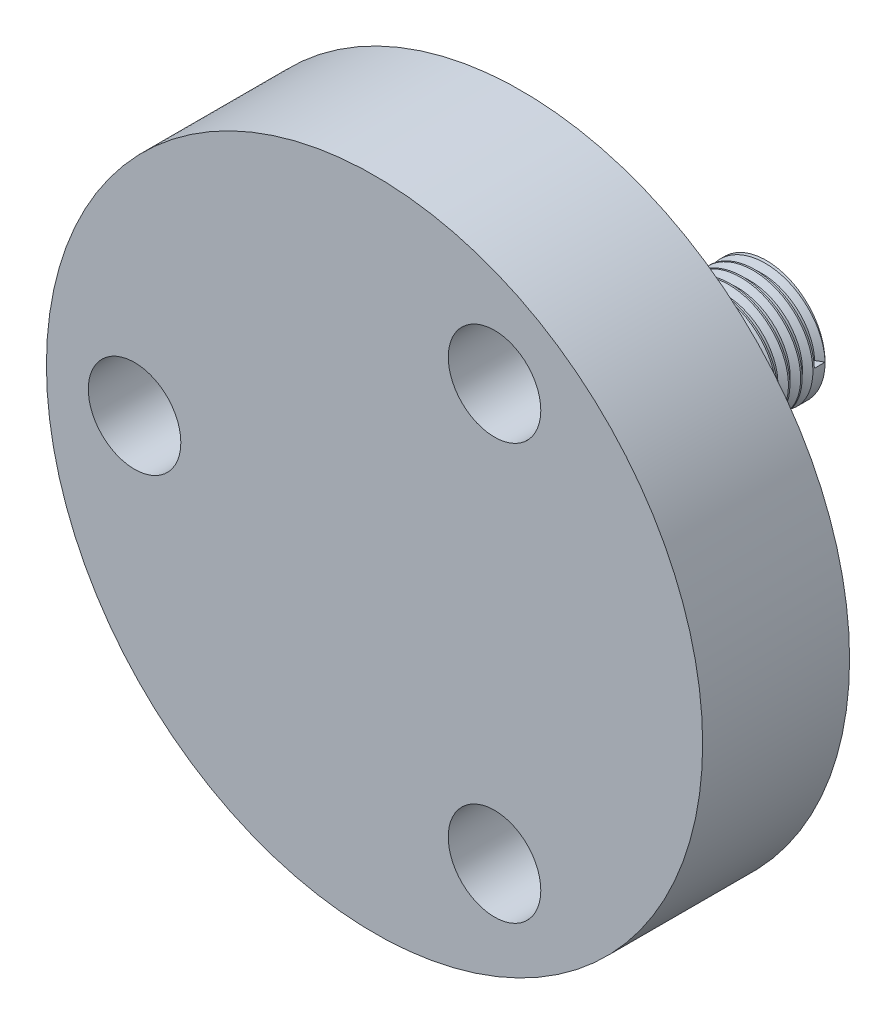
from build123d import *

# Parameters (mm, degrees)
SKETCH2_R            = 8.509
BOSS_EXTRUDE1_DEPTH  = 3.81
M2_CLEARANCE_HOLE1_D = 2.4
SKETCH8_R            = 1.524
BOSS_EXTRUDE2_DEPTH  = 6.35
THREAD1_PITCH        = 0.3175


with BuildPart() as part:
    # Sketch2 → Boss-Extrude1 (new body)
    with BuildSketch(Plane.XY):
        with Locations(Location((0, 0, 0), (0, 0, 180))):
            Circle(SKETCH2_R)
    extrude(amount=BOSS_EXTRUDE1_DEPTH)

    # M2 Clearance Hole1 (through all)
    with Locations(Plane.XY.offset(3.81)):
        with Locations((-6.223, 0), (3.1115, 5.389276088), (3.1115, -5.389276088)):
            Hole(M2_CLEARANCE_HOLE1_D / 2)

    # Sketch8 → Boss-Extrude2 (add)
    with BuildSketch(Plane(origin=(0, 0, 0), x_dir=(-1, 0, 0), z_dir=(0, 0, -1))):
        with Locations(Location((0, 0, 0), (0, 0, 180))):
            Circle(SKETCH8_R)
    extrude(amount=BOSS_EXTRUDE2_DEPTH)

    # Thread1: the profile of Thread Profile2 profile screwed along a right-hand helix of 20 turns, 6 arcs to a turn; built about Z, then put on its axis
    thread1_z = Axis((0, 0, 0), (0, 0, 1))
    thread1_corners = [(1.5243, 0, -0.000173205), (1.5243, 0, 0.277985704), (1.352148085, 0, 0.17859375), (1.352148085, 0, 0.09921875)]
    with BuildLine(mode=Mode.PRIVATE) as thread1_profile:
        Line(thread1_corners[0], thread1_corners[1])
        Line(thread1_corners[1], thread1_corners[2])
        Line(thread1_corners[2], thread1_corners[3])
        Line(thread1_corners[3], thread1_corners[0])
    thread1_cap = Face(thread1_profile.wire())
    thread1_turn_angles = [0, 30, 60, 90, 120, 150, 180, 210, 240, 270, 300, 330, 360]
    thread1_turn_weights = [1, 0.8660254037844387, 1, 0.8660254037844387, 1, 0.8660254037844387, 1, 0.8660254037844387, 1, 0.8660254037844387, 1, 0.8660254037844387, 1]
    thread1_turn_rails = [Edge.make_bspline([Vector(p[0], p[1], 0).rotate(thread1_z, thread1_turn_angles[k]) / thread1_turn_weights[k] + Vector(0, 0, p[2] + THREAD1_PITCH * thread1_turn_angles[k] / 360) for k in range(13)], [0, 0, 0, 1, 1, 2, 2, 3, 3, 4, 4, 5, 5, 6, 6, 6], 2, thread1_turn_weights) for p in thread1_corners]
    thread1_turn_sides = [Face.make_surface_from_curves(thread1_turn_rails[p[0]], thread1_turn_rails[p[1]]) for p in [(0, 1), (1, 2), (2, 3), (3, 0)]]
    thread1 = Plane(origin=(0, 0, -6.35), x_dir=(1, 0, 0), z_dir=(0, 0, 1)) * Solid(Shell([*[p.moved(Location((0, 0, THREAD1_PITCH * i))) for i in range(20) for p in thread1_turn_sides], thread1_cap, thread1_cap.rotate(thread1_z, 7200).moved(Location((0, 0, THREAD1_PITCH * 7200 / 360)))]))
    add(thread1, mode=Mode.SUBTRACT)


solid = part.part
